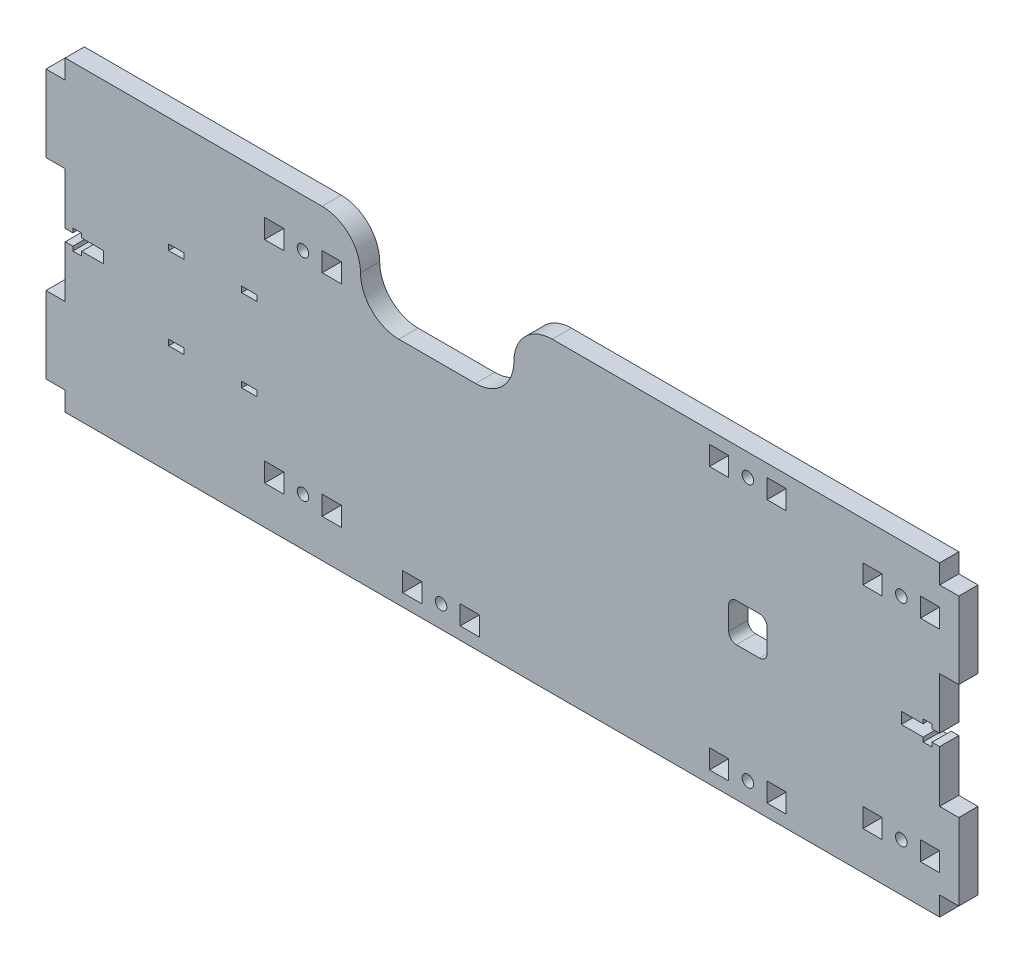
from build123d import *

# Parameters (mm, degrees)
ESQUISSE1_R        = 1.5
ESQUISSE1_W        = 4
ESQUISSE1_H        = 1.5
ESQUISSE1_W_2      = 5
ESQUISSE1_H_2      = 5
BOSS_EXTRU_1_DEPTH = 5
SKETCH1_W          = 40
SKETCH1_H          = 20
SKETCH1_W_2        = 10
SKETCH1_H_2        = 10
CUT_EXTRUDE1_DEPTH = 10
FILLET2_R          = 10
FILLET3_R          = 2


with BuildPart() as part:
    # Esquisse1 → Boss.-Extru.1 (new body)
    with BuildSketch(Plane.XY):
        Polygon((0, 35), (0, 15), (5, 15), (5, 1.5), (7, 1.5), (7, 2.6), (9.3, 2.6), (9.3, 1.5), (15, 1.5), (15, -1.5), (9.3, -1.5), (9.3, -2.6), (7, -2.6), (7, -1.5), (5, -1.5), (5, -15), (0, -15), (0, -35), (5, -35), (5, -40), (233, -40), (233, -35), (238, -35), (238, -15), (233, -15), (233, -1.5), (231, -1.5), (231, -2.6), (228.7, -2.6), (228.7, -1.5), (223, -1.5), (223, 1.5), (228.7, 1.5), (228.7, 2.6), (231, 2.6), (231, 1.5), (233, 1.5), (233, 15), (238, 15), (238, 35), (233, 35), (233, 40), (5, 40), (5, 35), align=None)
        with Locations((223, 27.5)):
            Circle(ESQUISSE1_R, mode=Mode.SUBTRACT)
        with Locations((223, -27.5)):
            Circle(ESQUISSE1_R, mode=Mode.SUBTRACT)
        with Locations((67, -27.5)):
            Circle(ESQUISSE1_R, mode=Mode.SUBTRACT)
        with Locations((67, 27.5)):
            Circle(ESQUISSE1_R, mode=Mode.SUBTRACT)
        with Locations((183, -34.25)):
            Circle(ESQUISSE1_R, mode=Mode.SUBTRACT)
        with Locations(Location((183, 34.25, 0), (0, 0, 90))):
            Circle(ESQUISSE1_R, mode=Mode.SUBTRACT)
        with Locations(Location((103, 34.25, 0), (0, 0, 90))):
            Circle(ESQUISSE1_R, mode=Mode.SUBTRACT)
        with Locations((103, -34.25)):
            Circle(ESQUISSE1_R, mode=Mode.SUBTRACT)
        with Locations((34, -10.75)):
            Rectangle(ESQUISSE1_W, ESQUISSE1_H, mode=Mode.SUBTRACT)
        with Locations((34, 10.75)):
            Rectangle(ESQUISSE1_W, ESQUISSE1_H, mode=Mode.SUBTRACT)
        with Locations((53, 10.75)):
            Rectangle(ESQUISSE1_W, ESQUISSE1_H, mode=Mode.SUBTRACT)
        with Locations((53, -10.75)):
            Rectangle(ESQUISSE1_W, ESQUISSE1_H, mode=Mode.SUBTRACT)
        with Locations((215.5, 27.5)):
            Rectangle(ESQUISSE1_W_2, ESQUISSE1_H_2, mode=Mode.SUBTRACT)
        with Locations((230.5, 27.5)):
            Rectangle(ESQUISSE1_W_2, ESQUISSE1_H_2, mode=Mode.SUBTRACT)
        with Locations((215.5, -27.5)):
            Rectangle(ESQUISSE1_W_2, ESQUISSE1_H_2, mode=Mode.SUBTRACT)
        with Locations((230.5, -27.5)):
            Rectangle(ESQUISSE1_W_2, ESQUISSE1_H_2, mode=Mode.SUBTRACT)
        with Locations((59.5, -27.5)):
            Rectangle(ESQUISSE1_W_2, ESQUISSE1_H_2, mode=Mode.SUBTRACT)
        with Locations((74.5, -27.5)):
            Rectangle(ESQUISSE1_W_2, ESQUISSE1_H_2, mode=Mode.SUBTRACT)
        with Locations((59.5, 27.5)):
            Rectangle(ESQUISSE1_W_2, ESQUISSE1_H_2, mode=Mode.SUBTRACT)
        with Locations((74.5, 27.5)):
            Rectangle(ESQUISSE1_W_2, ESQUISSE1_H_2, mode=Mode.SUBTRACT)
        with Locations((175.5, -34.25)):
            Rectangle(ESQUISSE1_W_2, ESQUISSE1_H_2, mode=Mode.SUBTRACT)
        with Locations((190.5, -34.25)):
            Rectangle(ESQUISSE1_W_2, ESQUISSE1_H_2, mode=Mode.SUBTRACT)
        with Locations((175.5, 34.25)):
            Rectangle(ESQUISSE1_W_2, ESQUISSE1_H_2, mode=Mode.SUBTRACT)
        with Locations((190.5, 34.25)):
            Rectangle(ESQUISSE1_W_2, ESQUISSE1_H_2, mode=Mode.SUBTRACT)
        with Locations((95.5, 34.25)):
            Rectangle(ESQUISSE1_W_2, ESQUISSE1_H_2, mode=Mode.SUBTRACT)
        with Locations((110.5, 34.25)):
            Rectangle(ESQUISSE1_W_2, ESQUISSE1_H_2, mode=Mode.SUBTRACT)
        with Locations((95.5, -34.25)):
            Rectangle(ESQUISSE1_W_2, ESQUISSE1_H_2, mode=Mode.SUBTRACT)
        with Locations((110.5, -34.25)):
            Rectangle(ESQUISSE1_W_2, ESQUISSE1_H_2, mode=Mode.SUBTRACT)
    extrude(amount=BOSS_EXTRU_1_DEPTH)

    # Sketch1 → Cut-Extrude1 (cut)
    with BuildSketch(Plane(origin=(0, 0, 0), x_dir=(-1, 0, 0), z_dir=(0, 0, -1))):
        with Locations((-102, 30)):
            Rectangle(SKETCH1_W, SKETCH1_H)
        with Locations((-183, 0)):
            Rectangle(SKETCH1_W_2, SKETCH1_H_2)
    extrude(amount=-CUT_EXTRUDE1_DEPTH, mode=Mode.SUBTRACT)

    # Fillet2
    fillet2_edges = [part.edges().sort_by_distance(p)[0] for p in [
        (122, 20, 2.5),
        (82, 20, 2.5),
    ]]
    fillet(fillet2_edges, radius=FILLET2_R)
    fillet2_2_edges = [part.edges().sort_by_distance(p)[0] for p in [
        (122, 40, 2.5),
        (82, 40, 2.5),
    ]]
    fillet(fillet2_2_edges, radius=FILLET2_R - 0.0001)  # a hair under: the kernel refuses the full size

    # Fillet3
    fillet3_edges = [part.edges().sort_by_distance(p)[0] for p in [
        (188, -5, 2.5),
        (188, 5, 2.5),
        (178, 5, 2.5),
        (178, -5, 2.5),
    ]]
    fillet(fillet3_edges, radius=FILLET3_R)


solid = part.part
